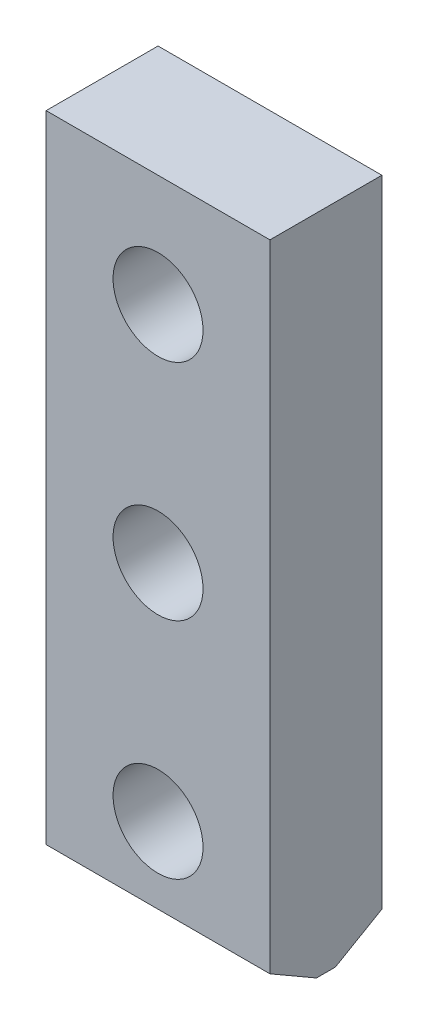
from build123d import *

# Parameters (mm, degrees)
SKETCH_1_W          = 50
SKETCH_1_H          = 148
EXTRUDE_1_DEPTH     = 25
SKETCH_2_R          = 10.05
CUT_EXTRUDE_1_DEPTH = 159.205562481
CHAMFER_1_SIZE      = 6
CHAMFER_1_SIZE2     = 10.392304845
CHAMFER_2_SIZE      = 6
CHAMFER_2_SIZE2     = 10.392304845


with BuildPart() as part:
    # Эскиз1 → Бобышка-Вытянуть1 (new body)
    with BuildSketch(Plane.XY):
        with Locations((25, 74)):
            Rectangle(SKETCH_1_W, SKETCH_1_H)
    extrude(amount=EXTRUDE_1_DEPTH)

    # Эскиз2 → Вырез-Вытянуть1 (cut, through all)
    with BuildSketch(Plane.XY.offset(25)):
        with Locations((25, 23)):
            Circle(SKETCH_2_R)
        with Locations((25, 73)):
            Circle(SKETCH_2_R)
        with Locations((25, 123)):
            Circle(SKETCH_2_R)
    extrude(amount=-CUT_EXTRUDE_1_DEPTH, mode=Mode.SUBTRACT)

    # Фаска1
    chamfer_1_edges = [part.edges().sort_by_distance(p)[0] for p in [
        (25, 0, 0),
    ]]
    chamfer_1_side = [part.faces().sort_by_distance(p)[0] for p in [
        (25, 1.562177967, 0),
    ]]
    chamfer(chamfer_1_edges, length=CHAMFER_1_SIZE, length2=CHAMFER_1_SIZE2, reference=chamfer_1_side[0])

    # Фаска2
    chamfer_2_edges = [part.edges().sort_by_distance(p)[0] for p in [
        (25, 0, 25),
    ]]
    chamfer_2_side = [part.faces().sort_by_distance(p)[0] for p in [
        (25, 1.562177967, 25),
    ]]
    chamfer(chamfer_2_edges, length=CHAMFER_2_SIZE, length2=CHAMFER_2_SIZE2, reference=chamfer_2_side[0])


solid = part.part
